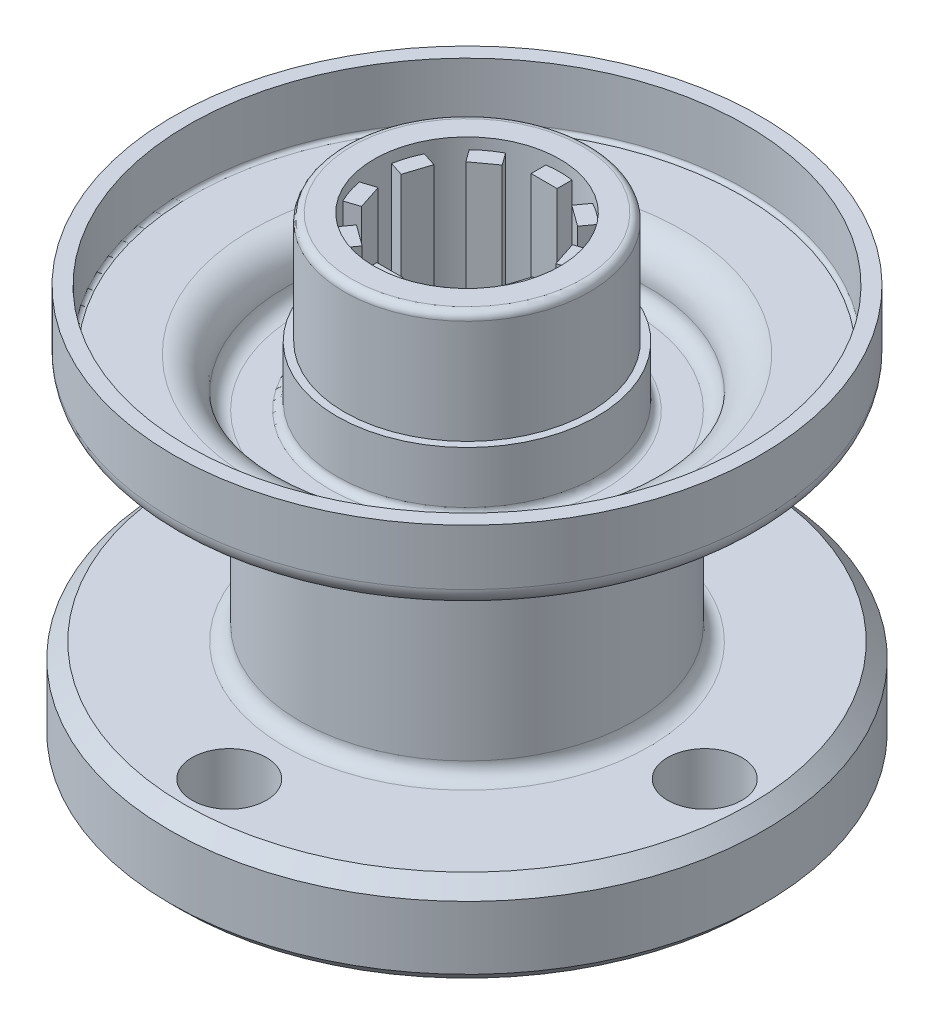
from build123d import *

# Parameters (mm, degrees)
SKETCH1_R       = 40
EXTRUDE1_DEPTH  = 12
SKETCH2_R       = 22.5
EXTRUDE2_DEPTH  = 50
SKETCH6_R       = 25
EXTRUDE5_DEPTH  = 6
SKETCH7_R       = 20
EXTRUDE6_DEPTH  = 12
SKETCH9_R       = 5
EXTRUDE8_DEPTH  = 20
EXTRUDE9_START  = -23
SKETCH10_R      = 22.5
SKETCH10_R_2    = 17.5
EXTRUDE9_DEPTH  = 23
EXTRUDE12_DEPTH = 44
EXTRUDE14_START = -1.5
SKETCH14_R      = 12.5
EXTRUDE14_DEPTH = 1.5
CHAMFER2_SIZE   = 2
CHAMFER3_SIZE   = 1.5
FILLET3_R       = 0.5
EXTRUDE15_START = -15
SKETCH15_R      = 20
SKETCH15_R_2    = 16.5
EXTRUDE15_DEPTH = 15
SKETCH16_R      = 12.5
EXTRUDE16_DEPTH = 1.5
FILLET4_R       = 1
FILLET5_R       = 2
FILLET6_R       = 1
SKETCH17_W      = 4
SKETCH17_H      = 0.5
CHAMFER4_SIZE   = 2


with BuildPart() as part:
    # Sketch1 → Extrude1 (new body)
    with BuildSketch(Plane(origin=(0, 0, 0), x_dir=(1, 0, 0), z_dir=(0, 1, 0))):
        with Locations(Location((0, 0, 0), (0, 0, 270))):
            Circle(SKETCH1_R)
    extrude(amount=EXTRUDE1_DEPTH)

    # Sketch2 → Extrude2 (add)
    with BuildSketch(Plane(origin=(0, 12, 0), x_dir=(1, 0, 0), z_dir=(0, 1, 0))):
        with Locations(Location((0, 0, 0), (0, 0, 270))):
            Circle(SKETCH2_R)
    extrude(amount=EXTRUDE2_DEPTH)

    # Sketch3 → Revolve1 (revolve)
    with BuildSketch(Plane.XY, mode=Mode.PRIVATE) as revolve1_sk:
        with BuildLine():
            Line((-29, 43.5), (-37, 43.5))
            ThreePointArc((-37, 43.5), (-38.767766953, 44.232233047), (-39.5, 46))
            Line((-39.5, 46), (-39.5, 53.5))
            Line((-39.5, 53.5), (-37.5, 53.5))
            Line((-37.5, 53.5), (-37.5, 46))
            ThreePointArc((-37.5, 46), (-37.353553391, 45.646446609), (-37, 45.5))
            Line((-37, 45.5), (-29, 45.5))
            ThreePointArc((-29, 45.5), (-25.818019485, 44.181980515), (-24.5, 41))
            ThreePointArc((-24.5, 41), (-23.914213562, 39.585786438), (-22.5, 39))
            Line((-22.5, 39), (0, 39))
            Line((0, 39), (0, 37))
            Line((0, 37), (-22.5, 37))
            ThreePointArc((-22.5, 37), (-25.328427125, 38.171572875), (-26.5, 41))
            ThreePointArc((-26.5, 41), (-27.232233047, 42.767766953), (-29, 43.5))
        make_face()
    revolve(revolve1_sk.sketch.rotate(Axis((0, 39, 0), (0, -1, 0)), 270), axis=Axis((0, 39, 0), (0, -1, 0)))

    # Sketch6 → Extrude5 (cut)
    with BuildSketch(Plane.XZ):
        with Locations(Location((0, 0, 0), (0, 0, 270))):
            Circle(SKETCH6_R)
    extrude(amount=-EXTRUDE5_DEPTH, mode=Mode.SUBTRACT)

    # Sketch7 → Extrude6 (cut)
    with BuildSketch(Plane.XZ.offset(-6)):
        with Locations(Location((0, 0, 0), (0, 0, 270))):
            Circle(SKETCH7_R)
    extrude(amount=-EXTRUDE6_DEPTH, mode=Mode.SUBTRACT)

    # Sketch9 → Extrude8 (cut)
    with BuildSketch(Plane.XZ):
        with Locations(Location((0, 32, 0), (0, 0, 270))):
            Circle(SKETCH9_R)
        with Locations(Location((32, 0, 0), (0, 0, 270))):
            Circle(SKETCH9_R)
        with Locations(Location((0, -32, 0), (0, 0, 270))):
            Circle(SKETCH9_R)
        with Locations(Location((-32, 0, 0), (0, 0, 270))):
            Circle(SKETCH9_R)
    extrude(amount=-EXTRUDE8_DEPTH, mode=Mode.SUBTRACT)

    # Sketch10 → Extrude9 (cut)
    with BuildSketch(Plane(origin=(0, 62, 0), x_dir=(1, 0, 0), z_dir=(0, 1, 0)).offset(EXTRUDE9_START)):
        with Locations(Location((0, 0, 0), (0, 0, 270))):
            Circle(SKETCH10_R)
        with Locations(Location((0, 0, 0), (0, 0, 270))):
            Circle(SKETCH10_R_2, mode=Mode.SUBTRACT)
    extrude(amount=EXTRUDE9_DEPTH, mode=Mode.SUBTRACT)

    # Sketch12 → Extrude12 (cut)
    with BuildSketch(Plane(origin=(0, 62, 0), x_dir=(-1, 0, 0), z_dir=(0, 1, 0))):
        with BuildLine():
            Line((-4.683605397, -9.42370762), (-7.515164877, -7.366459237))
            Line((-7.515164877, -7.366459237), (-8.690735382, -8.984493226))
            ThreePointArc((-8.690735382, -8.984493226), (-10.11271243, -7.347315654), (-11.230345755, -5.489019424))
            Line((-11.230345755, -5.489019424), (-9.328232722, -4.870985435))
            Line((-9.328232722, -4.870985435), (-10.409792202, -1.542287628))
            Line((-10.409792202, -1.542287628), (-12.311905235, -2.160321617))
            ThreePointArc((-12.311905235, -2.160321617), (-12.5, 0), (-12.311905235, 2.160321617))
            Line((-12.311905235, 2.160321617), (-10.409792202, 1.542287628))
            Line((-10.409792202, 1.542287628), (-9.328232722, 4.870985435))
            Line((-9.328232722, 4.870985435), (-11.230345755, 5.489019424))
            ThreePointArc((-11.230345755, 5.489019424), (-10.11271243, 7.347315654), (-8.690735382, 8.984493226))
            Line((-8.690735382, 8.984493226), (-7.515164877, 7.366459237))
            Line((-7.515164877, 7.366459237), (-4.683605397, 9.42370762))
            Line((-4.683605397, 9.42370762), (-5.859175901, 11.041741609))
            ThreePointArc((-5.859175901, 11.041741609), (-3.86271243, 11.888206454), (-1.75, 12.376893794))
            Line((-1.75, 12.376893794), (-1.75, 10.376893794))
            Line((-1.75, 10.376893794), (1.75, 10.376893794))
            Line((1.75, 10.376893794), (1.75, 12.376893794))
            ThreePointArc((1.75, 12.376893794), (3.86271243, 11.888206454), (5.859175901, 11.041741609))
            Line((5.859175901, 11.041741609), (4.683605397, 9.42370762))
            Line((4.683605397, 9.42370762), (7.515164877, 7.366459237))
            Line((7.515164877, 7.366459237), (8.690735382, 8.984493226))
            ThreePointArc((8.690735382, 8.984493226), (10.11271243, 7.347315654), (11.230345755, 5.489019424))
            Line((11.230345755, 5.489019424), (9.328232722, 4.870985435))
            Line((9.328232722, 4.870985435), (10.409792202, 1.542287628))
            Line((10.409792202, 1.542287628), (12.311905235, 2.160321617))
            ThreePointArc((12.311905235, 2.160321617), (12.5, 0), (12.311905235, -2.160321617))
            Line((12.311905235, -2.160321617), (10.409792202, -1.542287628))
            Line((10.409792202, -1.542287628), (9.328232722, -4.870985435))
            Line((9.328232722, -4.870985435), (11.230345755, -5.489019424))
            ThreePointArc((11.230345755, -5.489019424), (10.11271243, -7.347315654), (8.690735382, -8.984493226))
            Line((8.690735382, -8.984493226), (7.515164877, -7.366459237))
            Line((7.515164877, -7.366459237), (4.683605397, -9.42370762))
            Line((4.683605397, -9.42370762), (5.859175901, -11.041741609))
            ThreePointArc((5.859175901, -11.041741609), (3.86271243, -11.888206454), (1.75, -12.376893794))
            Line((1.75, -12.376893794), (1.75, -10.376893794))
            Line((1.75, -10.376893794), (-1.75, -10.376893794))
            Line((-1.75, -10.376893794), (-1.75, -12.376893794))
            ThreePointArc((-1.75, -12.376893794), (-3.86271243, -11.888206454), (-5.859175901, -11.041741609))
            Line((-5.859175901, -11.041741609), (-4.683605397, -9.42370762))
        make_face()
    extrude(amount=-EXTRUDE12_DEPTH, mode=Mode.SUBTRACT)

    # Sketch14 → Extrude14 (cut)
    with BuildSketch(Plane.XZ.offset(-18).offset(EXTRUDE14_START)):
        with Locations(Location((0, 0, 0), (0, 0, 81.952153753))):
            Circle(SKETCH14_R)
    extrude(amount=EXTRUDE14_DEPTH, mode=Mode.SUBTRACT)

    # Chamfer2
    chamfer2_edges = [part.edges().sort_by_distance(p)[0] for p in [
        (0, 12, -40),
    ]]
    chamfer(chamfer2_edges, length=CHAMFER2_SIZE)

    # Chamfer3
    chamfer3_edges = [part.edges().sort_by_distance(p)[0] for p in [
        (0, 0, -40),
    ]]
    chamfer(chamfer3_edges, length=CHAMFER3_SIZE)

    # Fillet3
    fillet3_edges = [part.edges().sort_by_distance(p)[0] for p in [
        (-7.347315654, 18, -10.11271243),
    ]]
    fillet(fillet3_edges, radius=FILLET3_R)

    # Sketch15 → Extrude15 (cut)
    with BuildSketch(Plane(origin=(0, 62, 0), x_dir=(1, 0, 0), z_dir=(0, 1, 0)).offset(EXTRUDE15_START)):
        with Locations(Location((0, 0, 0), (0, 0, 90))):
            Circle(SKETCH15_R)
        with Locations(Location((0, 0, 0), (0, 0, 270))):
            Circle(SKETCH15_R_2, mode=Mode.SUBTRACT)
    extrude(amount=EXTRUDE15_DEPTH, mode=Mode.SUBTRACT)

    # Sketch16 → Extrude16 (cut)
    with BuildSketch(Plane(origin=(0, 62, 0), x_dir=(-1, 0, 0), z_dir=(0, 1, 0))):
        with Locations(Location((0, 0, 0), (0, 0, 90))):
            Circle(SKETCH16_R)
    extrude(amount=-EXTRUDE16_DEPTH, mode=Mode.SUBTRACT)

    # Fillet4
    fillet4_edges = [part.edges().sort_by_distance(p)[0] for p in [
        (0, 62, -16.5),
    ]]
    fillet(fillet4_edges, radius=FILLET4_R)

    # Fillet5
    fillet5_edges = [part.edges().sort_by_distance(p)[0] for p in [
        (0, 12, -22.5),
    ]]
    fillet(fillet5_edges, radius=FILLET5_R)

    # Fillet6
    fillet6_edges = [part.edges().sort_by_distance(p)[0] for p in [
        (0, 39, -17.5),
    ]]
    fillet(fillet6_edges, radius=FILLET6_R)

    # Sketch17 → Cut-Revolve1 (revolve, cut)
    with BuildSketch(Plane.XY, mode=Mode.PRIVATE) as cut_revolve1_sk:
        with Locations((-22.5, 36.75)):
            Rectangle(SKETCH17_W, SKETCH17_H)
    revolve(cut_revolve1_sk.sketch.rotate(Axis((0, 0, 0), (0, 1, 0)), 270), axis=Axis((0, 0, 0), (0, 1, 0)), mode=Mode.SUBTRACT)

    # Chamfer4
    chamfer4_edges = [part.edges().sort_by_distance(p)[0] for p in [
        (0, 36.5, -22.5),
    ]]
    chamfer(chamfer4_edges, length=CHAMFER4_SIZE - 0.0001)  # a hair under: the kernel refuses the full size


solid = part.part
